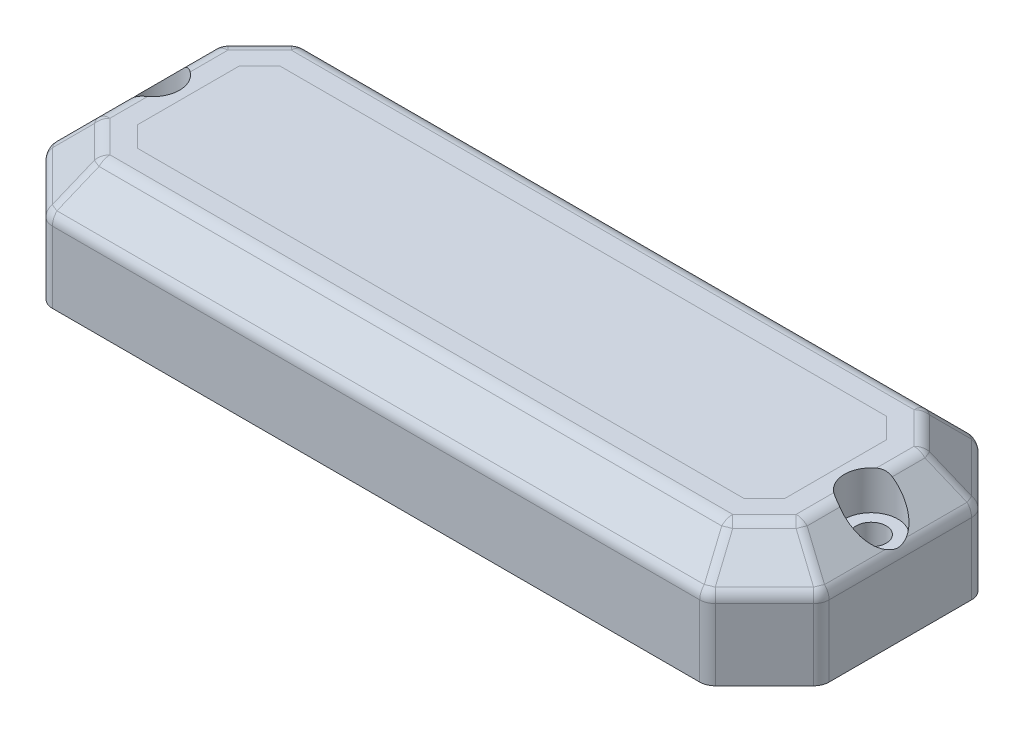
from build123d import *

# Parameters (mm, degrees)
BOSS_EXTRUDE1_DEPTH                            = 19.05
CHAMFER1_SIZE                                  = 6.35
SHELL2_T                                       = -2.54
FILLET1_R                                      = 2.54
FILLET2_R                                      = 2.54
BOSS_EXTRUDE7_REACH                            = 71.922
SKETCH5_W                                      = 8.037102448
SKETCH5_H                                      = 9.525
CBORE_FOR_8_BUTTON_HEAD_CAP_SCREW1_D           = 4.9149
CBORE_FOR_8_BUTTON_HEAD_CAP_SCREW1_CBORE_D     = 8.73252
CBORE_FOR_8_BUTTON_HEAD_CAP_SCREW1_CBORE_DEPTH = 6.35
FILLET3_R                                      = 2.54


with BuildPart() as part:
    # Sketch2 → Boss-Extrude1 (new body)
    with BuildSketch(Plane(origin=(0, 19.05, 0), x_dir=(1, 0, 0), z_dir=(0, 1, 0))):
        Polygon((-53.975, -22.225), (53.975, -22.225), (63.5, -12.7), (63.5, 12.7), (53.975, 22.225), (-53.975, 22.225), (-63.5, 12.7), (-63.5, -12.7), align=None)
    extrude(amount=BOSS_EXTRUDE1_DEPTH)

    # Chamfer1
    chamfer1_edges = [part.edges().sort_by_distance(p)[0] for p in [
        (58.7375, 38.1, 17.4625),
        (63.5, 38.1, 0),
        (58.7375, 38.1, -17.4625),
        (0, 38.1, -22.225),
        (-58.7375, 38.1, -17.4625),
        (-63.5, 38.1, 0),
        (-58.7375, 38.1, 17.4625),
        (0, 38.1, 22.225),
    ]]
    chamfer(chamfer1_edges, length=CHAMFER1_SIZE)

    # Shell2
    shell2_openings = [part.faces().sort_by_distance(p)[0] for p in [
        (0, 19.05, 0),
    ]]
    offset(amount=SHELL2_T, openings=shell2_openings, kind=Kind.INTERSECTION)

    # Fillet1
    # the kernel refuses this fillet: 2.54 mm, written as the material it takes off along each edge
    with BuildSketch(Plane(origin=(-56.097897552, 35.56, 9.633948776), x_dir=(-0.35740674433659325, -0.35740674433659325, 0.8628562094610168), z_dir=(-0.4397326120323051, 0.8794652240646093, 0.1821432117215268))) as fillet1_piece_1_section:
        Polygon((-3.340321719, -3.340321719), (3.340321719, -3.340321719), (3.340321719, 3.340321719), (-3.340321719, 3.340321719), align=None)
    fillet1_piece_1 = extrude(amount=3.340321719, mode=Mode.PRIVATE)
    fillet1_piece_1 = split(fillet1_piece_1, bisect_by=Plane(origin=(-56.097897552, 35.56, 9.633948776), z_dir=(0.6785983445458473, 0.6785983445458473, -0.2810846377148186)), keep=Keep.TOP, mode=Mode.PRIVATE)
    fillet1_piece_1 = split(fillet1_piece_1, bisect_by=Plane(origin=(-56.097897552, 35.56, 9.633948776), z_dir=(-0.7071067811865461, 0, -0.7071067811865488)), keep=Keep.TOP, mode=Mode.PRIVATE)
    fillet1_piece_1 = split(fillet1_piece_1, bisect_by=Plane(origin=(-56.097897552, 35.56, 9.633948776), z_dir=(0, 0, 1)), keep=Keep.TOP, mode=Mode.PRIVATE)
    fillet1_piece_1 = split(fillet1_piece_1, bisect_by=Plane(origin=(-57.893948776, 37.356051224, 9.633948776), z_dir=(0.7071067811865476, -0.7071067811865476, 0)), keep=Keep.TOP, mode=Mode.PRIVATE)
    fillet1_piece_1 = split(fillet1_piece_1, bisect_by=Plane(origin=(-57.367897552, 37.356051224, 10.903948776), z_dir=(0.5000000000000012, -0.7071067811865472, -0.4999999999999994)), keep=Keep.TOP, mode=Mode.PRIVATE)
    fillet1_piece_1 = split(fillet1_piece_1, bisect_by=Plane(origin=(-56.097897552, 38.1, 9.633948776), z_dir=(0, -1, 0)), keep=Keep.TOP, mode=Mode.PRIVATE)
    fillet1_piece_1 = fillet1_piece_1 - Plane(origin=(-56.097897552, 35.56, 9.633948776), x_dir=(0.4397326120323051, -0.8794652240646093, -0.1821432117215268), z_dir=(-0.35740674433659325, -0.35740674433659325, 0.8628562094610168)) * Sphere(FILLET1_R, mode=Mode.PRIVATE)
    add(fillet1_piece_1, mode=Mode.SUBTRACT)
    with BuildSketch(Plane(origin=(-50.908948776, 35.56, 14.822897552), x_dir=(0.8628562094610164, 0.35740674433659386, -0.35740674433659375), z_dir=(-0.18214321172152756, 0.8794652240646094, 0.43973261203230457))) as fillet1_piece_2_section:
        Polygon((-3.340321719, -3.340321719), (3.340321719, -3.340321719), (3.340321719, 3.340321719), (-3.340321719, 3.340321719), align=None)
    fillet1_piece_2 = extrude(amount=3.340321719, mode=Mode.PRIVATE)
    fillet1_piece_2 = split(fillet1_piece_2, bisect_by=Plane(origin=(-50.908948776, 35.56, 14.822897552), z_dir=(0.28108463771482023, 0.6785983445458471, -0.678598344545847)), keep=Keep.TOP, mode=Mode.PRIVATE)
    fillet1_piece_2 = split(fillet1_piece_2, bisect_by=Plane(origin=(-50.908948776, 35.56, 14.822897552), z_dir=(0.7071067811865461, 0, 0.7071067811865488)), keep=Keep.TOP, mode=Mode.PRIVATE)
    fillet1_piece_2 = split(fillet1_piece_2, bisect_by=Plane(origin=(-50.908948776, 35.56, 14.822897552), z_dir=(-1, 0, 0)), keep=Keep.TOP, mode=Mode.PRIVATE)
    fillet1_piece_2 = split(fillet1_piece_2, bisect_by=Plane(origin=(-50.908948776, 37.356051224, 16.618948776), z_dir=(0, -0.7071067811865475, -0.7071067811865476)), keep=Keep.TOP, mode=Mode.PRIVATE)
    fillet1_piece_2 = split(fillet1_piece_2, bisect_by=Plane(origin=(-52.178948776, 37.356051224, 16.092897552), z_dir=(0.5000000000000012, -0.7071067811865472, -0.4999999999999994)), keep=Keep.TOP, mode=Mode.PRIVATE)
    fillet1_piece_2 = split(fillet1_piece_2, bisect_by=Plane(origin=(-50.908948776, 38.1, 14.822897552), z_dir=(0, -1, 0)), keep=Keep.TOP, mode=Mode.PRIVATE)
    fillet1_piece_2 = fillet1_piece_2 - Plane(origin=(-50.908948776, 35.56, 14.822897552), x_dir=(0.18214321172152756, -0.8794652240646094, -0.43973261203230457), z_dir=(0.8628562094610164, 0.35740674433659386, -0.35740674433659375)) * Sphere(FILLET1_R, mode=Mode.PRIVATE)
    add(fillet1_piece_2, mode=Mode.SUBTRACT)
    with BuildSketch(Plane(origin=(50.908948776, 35.56, 14.822897552), x_dir=(0.8628562094610164, -0.3574067443365937, 0.3574067443365937), z_dir=(0.1821432117215275, 0.8794652240646094, 0.4397326120323043))) as fillet1_piece_3_section:
        Polygon((-3.340321719, -3.340321719), (3.340321719, -3.340321719), (3.340321719, 3.340321719), (-3.340321719, 3.340321719), align=None)
    fillet1_piece_3 = extrude(amount=3.340321719, mode=Mode.PRIVATE)
    fillet1_piece_3 = split(fillet1_piece_3, bisect_by=Plane(origin=(50.908948776, 35.56, 14.822897552), z_dir=(1, 0, 0)), keep=Keep.TOP, mode=Mode.PRIVATE)
    fillet1_piece_3 = split(fillet1_piece_3, bisect_by=Plane(origin=(50.908948776, 35.56, 14.822897552), z_dir=(-0.7071067811865457, 0, 0.7071067811865493)), keep=Keep.TOP, mode=Mode.PRIVATE)
    fillet1_piece_3 = split(fillet1_piece_3, bisect_by=Plane(origin=(50.908948776, 35.56, 14.822897552), z_dir=(-0.2810846377148212, 0.6785983445458469, -0.6785983445458468)), keep=Keep.TOP, mode=Mode.PRIVATE)
    fillet1_piece_3 = split(fillet1_piece_3, bisect_by=Plane(origin=(50.908948776, 37.356051224, 16.618948776), z_dir=(0, -0.7071067811865475, -0.7071067811865476)), keep=Keep.TOP, mode=Mode.PRIVATE)
    fillet1_piece_3 = split(fillet1_piece_3, bisect_by=Plane(origin=(50.908948776, 38.1, 14.822897552), z_dir=(0, -1, 0)), keep=Keep.TOP, mode=Mode.PRIVATE)
    fillet1_piece_3 = split(fillet1_piece_3, bisect_by=Plane(origin=(52.178948776, 37.356051224, 16.092897552), z_dir=(-0.5000000000000013, -0.7071067811865475, -0.4999999999999987)), keep=Keep.TOP, mode=Mode.PRIVATE)
    fillet1_piece_3 = fillet1_piece_3 - Plane(origin=(50.908948776, 35.56, 14.822897552), x_dir=(-0.1821432117215275, -0.8794652240646094, -0.4397326120323043), z_dir=(0.8628562094610164, -0.3574067443365937, 0.3574067443365937)) * Sphere(FILLET1_R, mode=Mode.PRIVATE)
    add(fillet1_piece_3, mode=Mode.SUBTRACT)
    with BuildSketch(Plane(origin=(56.097897552, 35.56, 9.633948776), x_dir=(-0.3574067443365929, 0.3574067443365929, -0.862856209461017), z_dir=(0.4397326120323051, 0.8794652240646093, 0.18214321172152656))) as fillet1_piece_4_section:
        Polygon((-3.340321719, -3.340321719), (3.340321719, -3.340321719), (3.340321719, 3.340321719), (-3.340321719, 3.340321719), align=None)
    fillet1_piece_4 = extrude(amount=3.340321719, mode=Mode.PRIVATE)
    fillet1_piece_4 = split(fillet1_piece_4, bisect_by=Plane(origin=(56.097897552, 35.56, 9.633948776), z_dir=(0, 0, 1)), keep=Keep.TOP, mode=Mode.PRIVATE)
    fillet1_piece_4 = split(fillet1_piece_4, bisect_by=Plane(origin=(56.097897552, 35.56, 9.633948776), z_dir=(0.7071067811865457, 0, -0.7071067811865493)), keep=Keep.TOP, mode=Mode.PRIVATE)
    fillet1_piece_4 = split(fillet1_piece_4, bisect_by=Plane(origin=(56.097897552, 35.56, 9.633948776), z_dir=(-0.6785983445458473, 0.6785983445458473, -0.28108463771481923)), keep=Keep.TOP, mode=Mode.PRIVATE)
    fillet1_piece_4 = split(fillet1_piece_4, bisect_by=Plane(origin=(57.893948776, 37.356051224, 9.633948776), z_dir=(-0.7071067811865476, -0.7071067811865476, 0)), keep=Keep.TOP, mode=Mode.PRIVATE)
    fillet1_piece_4 = split(fillet1_piece_4, bisect_by=Plane(origin=(56.097897552, 38.1, 9.633948776), z_dir=(0, -1, 0)), keep=Keep.TOP, mode=Mode.PRIVATE)
    fillet1_piece_4 = split(fillet1_piece_4, bisect_by=Plane(origin=(57.367897552, 37.356051224, 10.903948776), z_dir=(-0.5000000000000013, -0.7071067811865475, -0.4999999999999987)), keep=Keep.TOP, mode=Mode.PRIVATE)
    fillet1_piece_4 = fillet1_piece_4 - Plane(origin=(56.097897552, 35.56, 9.633948776), x_dir=(-0.4397326120323051, -0.8794652240646093, -0.18214321172152656), z_dir=(-0.3574067443365929, 0.3574067443365929, -0.862856209461017)) * Sphere(FILLET1_R, mode=Mode.PRIVATE)
    add(fillet1_piece_4, mode=Mode.SUBTRACT)
    with BuildSketch(Plane(origin=(56.097897552, 35.56, -9.633948776), x_dir=(0.3574067443365929, -0.3574067443365929, -0.8628562094610169), z_dir=(0.4397326120323049, 0.8794652240646093, -0.18214321172152667))) as fillet1_piece_5_section:
        Polygon((-3.340321719, -3.340321719), (3.340321719, -3.340321719), (3.340321719, 3.340321719), (-3.340321719, 3.340321719), align=None)
    fillet1_piece_5 = extrude(amount=3.340321719, mode=Mode.PRIVATE)
    fillet1_piece_5 = split(fillet1_piece_5, bisect_by=Plane(origin=(56.097897552, 35.56, -9.633948776), z_dir=(0, 0, -1)), keep=Keep.TOP, mode=Mode.PRIVATE)
    fillet1_piece_5 = split(fillet1_piece_5, bisect_by=Plane(origin=(56.097897552, 35.56, -9.633948776), z_dir=(0.7071067811865462, 0, 0.7071067811865487)), keep=Keep.TOP, mode=Mode.PRIVATE)
    fillet1_piece_5 = split(fillet1_piece_5, bisect_by=Plane(origin=(56.097897552, 35.56, -9.633948776), z_dir=(-0.6785983445458471, 0.6785983445458471, 0.28108463771481995)), keep=Keep.TOP, mode=Mode.PRIVATE)
    fillet1_piece_5 = split(fillet1_piece_5, bisect_by=Plane(origin=(57.893948776, 37.356051224, -9.633948776), z_dir=(-0.7071067811865476, -0.7071067811865476, 0)), keep=Keep.TOP, mode=Mode.PRIVATE)
    fillet1_piece_5 = split(fillet1_piece_5, bisect_by=Plane(origin=(56.097897552, 38.1, -9.633948776), z_dir=(0, -1, 0)), keep=Keep.TOP, mode=Mode.PRIVATE)
    fillet1_piece_5 = split(fillet1_piece_5, bisect_by=Plane(origin=(57.367897552, 37.356051224, -10.903948776), z_dir=(-0.5000000000000009, -0.7071067811865478, 0.4999999999999991)), keep=Keep.TOP, mode=Mode.PRIVATE)
    fillet1_piece_5 = fillet1_piece_5 - Plane(origin=(56.097897552, 35.56, -9.633948776), x_dir=(-0.4397326120323049, -0.8794652240646093, 0.18214321172152667), z_dir=(0.3574067443365929, -0.3574067443365929, -0.8628562094610169)) * Sphere(FILLET1_R, mode=Mode.PRIVATE)
    add(fillet1_piece_5, mode=Mode.SUBTRACT)
    with BuildSketch(Plane(origin=(50.908948776, 35.56, -14.822897552), x_dir=(-0.8628562094610168, 0.35740674433659336, 0.3574067443365932), z_dir=(0.1821432117215274, 0.8794652240646095, -0.4397326120323043))) as fillet1_piece_6_section:
        Polygon((-3.340321719, -3.340321719), (3.340321719, -3.340321719), (3.340321719, 3.340321719), (-3.340321719, 3.340321719), align=None)
    fillet1_piece_6 = extrude(amount=3.340321719, mode=Mode.PRIVATE)
    fillet1_piece_6 = split(fillet1_piece_6, bisect_by=Plane(origin=(50.908948776, 35.56, -14.822897552), z_dir=(1, 0, 0)), keep=Keep.TOP, mode=Mode.PRIVATE)
    fillet1_piece_6 = split(fillet1_piece_6, bisect_by=Plane(origin=(50.908948776, 35.56, -14.822897552), z_dir=(-0.7071067811865462, 0, -0.7071067811865487)), keep=Keep.TOP, mode=Mode.PRIVATE)
    fillet1_piece_6 = split(fillet1_piece_6, bisect_by=Plane(origin=(50.908948776, 35.56, -14.822897552), z_dir=(-0.2810846377148214, 0.6785983445458469, 0.6785983445458468)), keep=Keep.TOP, mode=Mode.PRIVATE)
    fillet1_piece_6 = split(fillet1_piece_6, bisect_by=Plane(origin=(50.908948776, 37.356051224, -16.618948776), z_dir=(0, -0.7071067811865475, 0.7071067811865476)), keep=Keep.TOP, mode=Mode.PRIVATE)
    fillet1_piece_6 = split(fillet1_piece_6, bisect_by=Plane(origin=(50.908948776, 38.1, -14.822897552), z_dir=(0, -1, 0)), keep=Keep.TOP, mode=Mode.PRIVATE)
    fillet1_piece_6 = split(fillet1_piece_6, bisect_by=Plane(origin=(52.178948776, 37.356051224, -16.092897552), z_dir=(-0.5000000000000009, -0.7071067811865478, 0.4999999999999991)), keep=Keep.TOP, mode=Mode.PRIVATE)
    fillet1_piece_6 = fillet1_piece_6 - Plane(origin=(50.908948776, 35.56, -14.822897552), x_dir=(-0.1821432117215274, -0.8794652240646095, 0.4397326120323043), z_dir=(-0.8628562094610168, 0.35740674433659336, 0.3574067443365932)) * Sphere(FILLET1_R, mode=Mode.PRIVATE)
    add(fillet1_piece_6, mode=Mode.SUBTRACT)
    with BuildSketch(Plane(origin=(-50.908948776, 35.56, -14.822897552), x_dir=(-0.35740674433659053, 0.3574067443365938, 0.8628562094610178), z_dir=(-0.18214321172152756, 0.8794652240646094, -0.4397326120323043))) as fillet1_piece_7_section:
        Polygon((-3.340321719, -3.340321719), (3.340321719, -3.340321719), (3.340321719, 3.340321719), (-3.340321719, 3.340321719), align=None)
    fillet1_piece_7 = extrude(amount=3.340321719, mode=Mode.PRIVATE)
    fillet1_piece_7 = split(fillet1_piece_7, bisect_by=Plane(origin=(-50.908948776, 35.56, -14.822897552), z_dir=(0.7071067811865457, 0, -0.7071067811865495)), keep=Keep.TOP, mode=Mode.PRIVATE)
    fillet1_piece_7 = split(fillet1_piece_7, bisect_by=Plane(origin=(-50.908948776, 35.56, -14.822897552), z_dir=(-1, 0, 0)), keep=Keep.TOP, mode=Mode.PRIVATE)
    fillet1_piece_7 = split(fillet1_piece_7, bisect_by=Plane(origin=(-50.908948776, 35.56, -14.822897552), z_dir=(0.2810846377148211, 0.6785983445458469, 0.6785983445458468)), keep=Keep.TOP, mode=Mode.PRIVATE)
    fillet1_piece_7 = split(fillet1_piece_7, bisect_by=Plane(origin=(-52.178948776, 37.356051224, -16.092897552), z_dir=(0.5000000000000014, -0.7071067811865475, 0.4999999999999988)), keep=Keep.TOP, mode=Mode.PRIVATE)
    fillet1_piece_7 = split(fillet1_piece_7, bisect_by=Plane(origin=(-50.908948776, 38.1, -14.822897552), z_dir=(0, -1, 0)), keep=Keep.TOP, mode=Mode.PRIVATE)
    fillet1_piece_7 = split(fillet1_piece_7, bisect_by=Plane(origin=(-50.908948776, 37.356051224, -16.618948776), z_dir=(0, -0.7071067811865475, 0.7071067811865476)), keep=Keep.TOP, mode=Mode.PRIVATE)
    fillet1_piece_7 = fillet1_piece_7 - Plane(origin=(-50.908948776, 35.56, -14.822897552), x_dir=(0.18214321172152756, -0.8794652240646094, 0.4397326120323043), z_dir=(-0.35740674433659053, 0.3574067443365938, 0.8628562094610178)) * Sphere(FILLET1_R, mode=Mode.PRIVATE)
    add(fillet1_piece_7, mode=Mode.SUBTRACT)
    with BuildSketch(Plane(origin=(-56.097897552, 35.56, -9.633948776), x_dir=(-0.8628562094610157, -0.35740674433659286, 0.35740674433659625), z_dir=(-0.4397326120323052, 0.8794652240646093, -0.1821432117215266))) as fillet1_piece_8_section:
        Polygon((-3.340321719, -3.340321719), (3.340321719, -3.340321719), (3.340321719, 3.340321719), (-3.340321719, 3.340321719), align=None)
    fillet1_piece_8 = extrude(amount=3.340321719, mode=Mode.PRIVATE)
    fillet1_piece_8 = split(fillet1_piece_8, bisect_by=Plane(origin=(-56.097897552, 35.56, -9.633948776), z_dir=(0.6785983445458473, 0.6785983445458473, 0.2810846377148191)), keep=Keep.TOP, mode=Mode.PRIVATE)
    fillet1_piece_8 = split(fillet1_piece_8, bisect_by=Plane(origin=(-56.097897552, 35.56, -9.633948776), z_dir=(0, 0, -1)), keep=Keep.TOP, mode=Mode.PRIVATE)
    fillet1_piece_8 = split(fillet1_piece_8, bisect_by=Plane(origin=(-56.097897552, 35.56, -9.633948776), z_dir=(-0.7071067811865457, 0, 0.7071067811865495)), keep=Keep.TOP, mode=Mode.PRIVATE)
    fillet1_piece_8 = split(fillet1_piece_8, bisect_by=Plane(origin=(-57.367897552, 37.356051224, -10.903948776), z_dir=(0.5000000000000014, -0.7071067811865475, 0.4999999999999988)), keep=Keep.TOP, mode=Mode.PRIVATE)
    fillet1_piece_8 = split(fillet1_piece_8, bisect_by=Plane(origin=(-57.893948776, 37.356051224, -9.633948776), z_dir=(0.7071067811865476, -0.7071067811865476, 0)), keep=Keep.TOP, mode=Mode.PRIVATE)
    fillet1_piece_8 = split(fillet1_piece_8, bisect_by=Plane(origin=(-56.097897552, 38.1, -9.633948776), z_dir=(0, -1, 0)), keep=Keep.TOP, mode=Mode.PRIVATE)
    fillet1_piece_8 = fillet1_piece_8 - Plane(origin=(-56.097897552, 35.56, -9.633948776), x_dir=(0.4397326120323052, -0.8794652240646093, 0.1821432117215266), z_dir=(-0.8628562094610157, -0.35740674433659286, 0.35740674433659625)) * Sphere(FILLET1_R, mode=Mode.PRIVATE)
    add(fillet1_piece_8, mode=Mode.SUBTRACT)
    with BuildSketch(Plane(origin=(-56.841846327, 38.1, 10.377897552), x_dir=(-0.5000000000000009, -0.7071067811865476, 0.49999999999999917), z_dir=(0.7071067811865464, 0, 0.7071067811865487))) as fillet1_piece_9:
        with BuildLine():
            CenterArc((FILLET1_R * 0.414213562373, FILLET1_R), FILLET1_R, 225, 45)
            Line((-FILLET1_R * 0.292893218813, FILLET1_R * 0.292893218813), (0, 0))
            Line((0, 0), (FILLET1_R * 0.414213562373, 0))
        make_face()
    extrude(amount=7.338281733, mode=Mode.SUBTRACT)
    with BuildSketch(Plane(origin=(-50.908948776, 38.1, 15.875), x_dir=(0, -0.7071067811865467, 0.7071067811865483), z_dir=(1, 0, 0))) as fillet1_piece_10:
        with BuildLine():
            CenterArc((FILLET1_R * 0.414213562373, FILLET1_R), FILLET1_R, 225, 45)
            Line((-FILLET1_R * 0.292893218813, FILLET1_R * 0.292893218813), (0, 0))
            Line((0, 0), (FILLET1_R * 0.414213562373, 0))
        make_face()
    extrude(amount=101.817897552, mode=Mode.SUBTRACT)
    with BuildSketch(Plane(origin=(51.652897552, 38.1, 15.566846327), x_dir=(-0.7071067811865492, 0, -0.7071067811865459), z_dir=(0.7071067811865458, 0, -0.7071067811865492)), Plane(origin=(56.841846327, 38.1, -10.377897552), x_dir=(-0.7071067811865487, 0, 0.7071067811865464), z_dir=(-0.7071067811865464, 0, -0.7071067811865487)), Plane(origin=(-51.652897552, 38.1, -15.566846327), x_dir=(0.7071067811865493, 0, 0.7071067811865458), z_dir=(-0.7071067811865458, 0, 0.7071067811865493))) as fillet1_piece_11:
        with BuildLine():
            CenterArc((FILLET1_R * 0.414213562373, -FILLET1_R), FILLET1_R, 90, 45)
            Line((-FILLET1_R * 0.292893218813, -FILLET1_R * 0.292893218813), (0, 0))
            Line((0, 0), (FILLET1_R * 0.414213562373, 0))
        make_face()
    extrude(amount=7.338281733, mode=Mode.SUBTRACT)
    with BuildSketch(Plane(origin=(57.15, 38.1, 9.633948776), x_dir=(-1, 0, 0), z_dir=(0, 0, -1)), Plane(origin=(-57.15, 38.1, -9.633948776), x_dir=(1, 0, 0), z_dir=(0, 0, 1))) as fillet1_piece_12:
        with BuildLine():
            CenterArc((FILLET1_R * 0.414213562373, -FILLET1_R), FILLET1_R, 90, 45)
            Line((-FILLET1_R * 0.292893218813, -FILLET1_R * 0.292893218813), (0, 0))
            Line((0, 0), (FILLET1_R * 0.414213562373, 0))
        make_face()
    extrude(amount=19.267897552, mode=Mode.SUBTRACT)
    with BuildSketch(Plane(origin=(50.908948776, 38.1, -15.875), x_dir=(0, 0, 1), z_dir=(-1, 0, 0))) as fillet1_piece_13:
        with BuildLine():
            CenterArc((FILLET1_R * 0.414213562373, -FILLET1_R), FILLET1_R, 90, 45)
            Line((-FILLET1_R * 0.292893218813, -FILLET1_R * 0.292893218813), (0, 0))
            Line((0, 0), (FILLET1_R * 0.414213562373, 0))
        make_face()
    extrude(amount=101.817897552, mode=Mode.SUBTRACT)
    with BuildSketch(Plane(origin=(-63.5, 16.419743879, 12.7), x_dir=(0.7071067811865475, 0, 0.7071067811865475), z_dir=(0, 1, 0)), Plane(origin=(-63.5, 16.419743879, -12.7), x_dir=(0, 0, 1), z_dir=(0, 1, 0)), Plane(origin=(-53.975, 16.419743879, 22.225), x_dir=(1, 0, 0), z_dir=(0, 1, 0))) as fillet1_piece_14:
        with BuildLine():
            CenterArc((FILLET1_R * 0.414213562373, FILLET1_R), FILLET1_R, 225, 45)
            Line((-FILLET1_R * 0.292893218813, FILLET1_R * 0.292893218813), (0, 0))
            Line((0, 0), (FILLET1_R * 0.414213562373, 0))
        make_face()
    extrude(amount=17.960512242, mode=Mode.SUBTRACT)
    with BuildSketch(Plane(origin=(-53.975, 16.419743879, -22.225), x_dir=(1, 0, 0), z_dir=(0, 1, 0)), Plane(origin=(53.975, 16.419743879, -22.225), x_dir=(0.7071067811865441, 0, 0.7071067811865509), z_dir=(0, 1, 0)), Plane(origin=(63.5, 16.419743879, -12.7), x_dir=(0, 0, 1), z_dir=(0, 1, 0)), Plane(origin=(63.5, 16.419743879, 12.7), x_dir=(-0.7071067811865466, 0, 0.7071067811865483), z_dir=(0, 1, 0)), Plane(origin=(53.975, 16.419743879, 22.225), x_dir=(-1, 0, 0), z_dir=(0, 1, 0))) as fillet1_piece_15:
        with BuildLine():
            CenterArc((FILLET1_R * 0.414213562373, -FILLET1_R), FILLET1_R, 90, 45)
            Line((-FILLET1_R * 0.292893218813, -FILLET1_R * 0.292893218813), (0, 0))
            Line((0, 0), (FILLET1_R * 0.414213562373, 0))
        make_face()
    extrude(amount=17.960512242, mode=Mode.SUBTRACT)
    with BuildSketch(Plane(origin=(64.711221668, 30.538778332, -13.201704442), x_dir=(0.19875685341551821, -0.19875685341550825, 0.9596829822606674), z_dir=(-0.6785983445458471, 0.6785983445458471, 0.28108463771482)), Plane(origin=(64.711221668, 30.538778332, 13.201704442), x_dir=(-0.5380560256884358, -0.19875685341551344, 0.8191406634032579), z_dir=(-0.6785983445458473, 0.6785983445458473, -0.2810846377148192)), Plane(origin=(54.476704442, 30.538778332, -23.436221668), x_dir=(0.8191406634032595, -0.1987568534155089, 0.5380560256884348), z_dir=(-0.2810846377148213, 0.6785983445458469, 0.6785983445458468)), Plane(origin=(54.476704442, 30.538778332, 23.436221668), x_dir=(-0.9596829822606671, -0.19875685341551402, 0.19875685341551402), z_dir=(-0.2810846377148212, 0.6785983445458469, -0.6785983445458468)), Plane(origin=(-54.476704442, 30.538778332, -23.436221668), x_dir=(0.9596829822606671, -0.19875685341551397, -0.19875685341551397), z_dir=(0.2810846377148212, 0.678598344545847, 0.6785983445458469))) as fillet1_piece_16:
        with BuildLine():
            CenterArc((FILLET1_R * 0.281084637715, -FILLET1_R), FILLET1_R, 90, 31.39971481)
            Line((-FILLET1_R * 0.239920745565, -FILLET1_R * 0.146446609407), (0, 0))
            Line((0, 0), (FILLET1_R * 0.281084637715, 0))
        make_face()
    extrude(amount=10.255221507, mode=Mode.SUBTRACT)
    with BuildSketch(Plane(origin=(-54.476704442, 30.538778332, 23.436221668), x_dir=(0.9596829822606672, -0.19875685341551588, 0.19875685341551091), z_dir=(0.2810846377148203, 0.6785983445458471, -0.678598344545847)), Plane(origin=(-64.711221668, 30.538778332, -13.201704442), x_dir=(-0.19875685341551752, -0.19875685341550756, 0.9596829822606675), z_dir=(0.6785983445458473, 0.6785983445458473, 0.28108463771481906)), Plane(origin=(-64.711221668, 30.538778332, 13.201704442), x_dir=(0.5380560256884318, -0.19875685341550844, 0.8191406634032616), z_dir=(0.6785983445458474, 0.6785983445458474, -0.28108463771481873))) as fillet1_piece_17:
        with BuildLine():
            CenterArc((FILLET1_R * 0.281084637715, FILLET1_R), FILLET1_R, 238.60028519, 31.39971481)
            Line((-FILLET1_R * 0.239920745565, FILLET1_R * 0.146446609407), (0, 0))
            Line((0, 0), (FILLET1_R * 0.281084637715, 0))
        make_face()
    extrude(amount=10.255221507, mode=Mode.SUBTRACT)

    # Fillet2
    fillet2_edges = [part.edges().sort_by_distance(p)[0] for p in [
        (-63.306654013, 31.809333338, -12.61991347),
        (-63.5, 31.75, 0),
        (-63.306654013, 31.809333338, 12.61991347),
        (-58.7375, 31.75, 17.4625),
        (-53.89491347, 31.809333338, 22.031654013),
        (0, 31.75, 22.225),
        (53.89491347, 31.809333338, 22.031654013),
        (58.7375, 31.75, 17.4625),
        (63.306654013, 31.809333338, 12.61991347),
        (63.5, 31.75, 0),
        (63.306654013, 31.809333338, -12.61991347),
        (58.7375, 31.75, -17.4625),
        (53.89491347, 31.809333338, -22.031654013),
        (0, 31.75, -22.225),
        (-53.89491347, 31.809333338, -22.031654013),
        (-58.7375, 31.75, -17.4625),
    ]]
    fillet(fillet2_edges, radius=FILLET2_R)

    # Sketch5 → Boss-Extrude7 (add, up to next)
    with BuildSketch(Plane.XZ.offset(-19.05), mode=Mode.PRIVATE) as boss_extrude7_sk1:
        with Locations((-56.941448776, 0)):
            Rectangle(SKETCH5_W, SKETCH5_H)
    boss_extrude7_tool1 = extrude(boss_extrude7_sk1.sketch, amount=-BOSS_EXTRUDE7_REACH, mode=Mode.PRIVATE) - part.part
    # Sketch5 → Boss-Extrude7 (add, up to next)
    with BuildSketch(Plane.XZ.offset(-19.05), mode=Mode.PRIVATE) as boss_extrude7_sk2:
        with Locations((56.941448776, 0)):
            Rectangle(SKETCH5_W, SKETCH5_H)
    boss_extrude7_tool2 = extrude(boss_extrude7_sk2.sketch, amount=-BOSS_EXTRUDE7_REACH, mode=Mode.PRIVATE) - part.part
    add(boss_extrude7_tool1.solids().sort_by_distance((-56.941449, 19.05, 0))[0])
    add(boss_extrude7_tool2.solids().sort_by_distance((56.941449, 19.05, 0))[0])

    # CBORE for #8 Button Head Cap Screw1 (through all)
    with Locations(Plane(origin=(0, 38.1, 0), x_dir=(1, 0, 0), z_dir=(0, 1, 0))):
        with Locations((-58.7375, 0), (58.7375, 0)):
            CounterBoreHole(CBORE_FOR_8_BUTTON_HEAD_CAP_SCREW1_D / 2, CBORE_FOR_8_BUTTON_HEAD_CAP_SCREW1_CBORE_D / 2, CBORE_FOR_8_BUTTON_HEAD_CAP_SCREW1_CBORE_DEPTH)

    # Fillet3
    fillet3_edges = [part.edges().sort_by_distance(p)[0] for p in [
        (-52.922897552, 27.305, -4.7625),
        (-60.96, 24.873948776, 4.7625),
        (-52.922897552, 27.305, 4.7625),
        (-60.96, 24.873948776, -4.7625),
        (52.922897552, 27.305, 4.7625),
        (60.96, 24.873948776, -4.7625),
        (52.922897552, 27.305, -4.7625),
        (60.96, 24.873948776, 4.7625),
        (-60.96, 24.873948776, 11.647897552),
        (-52.922897552, 24.873948776, 19.685),
        (52.922897552, 24.873948776, 19.685),
        (60.96, 24.873948776, 11.647897552),
        (60.96, 24.873948776, -11.647897552),
        (52.922897552, 24.873948776, -19.685),
        (-52.922897552, 24.873948776, -19.685),
        (-60.96, 24.873948776, -11.647897552),
    ]]
    fillet(fillet3_edges, radius=FILLET3_R)


solid = part.part
